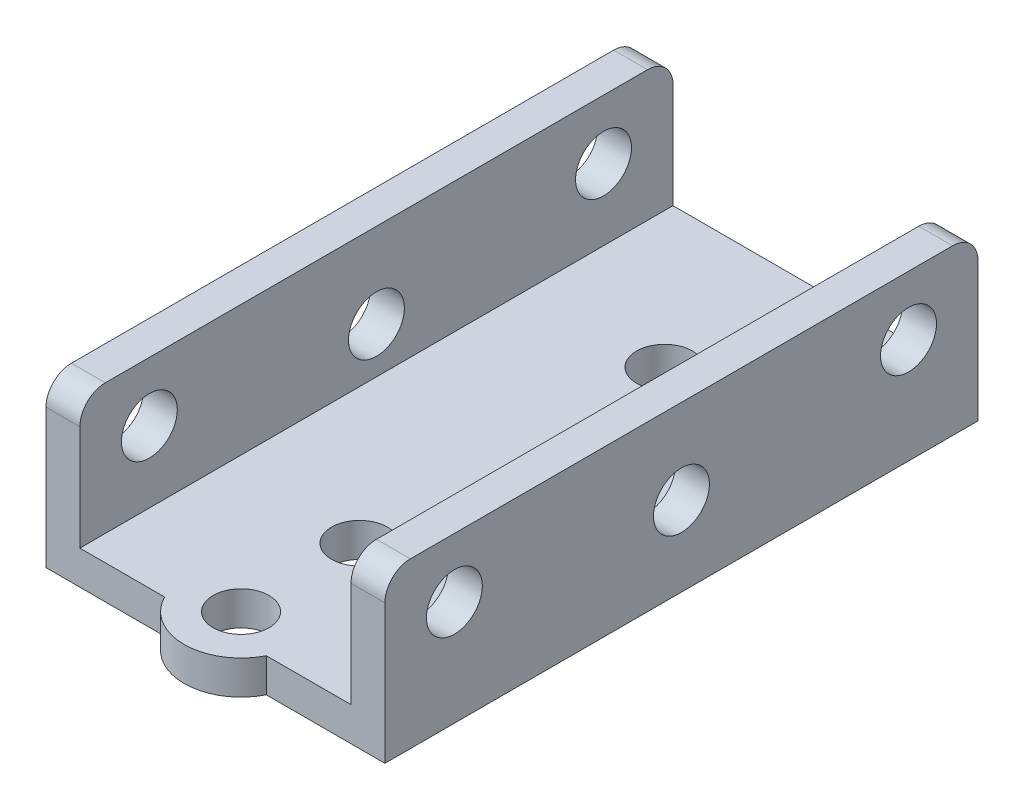
from build123d import *

# Parameters (mm, degrees)
IZIM1_W                     = 16
IZIM1_H                     = 35
IZIM1_R                     = 1.65
Y_KSEKLIK_EKSTR_ZYON1_DEPTH = 2
IZIM3_W                     = 2
IZIM3_H                     = 35
Y_KSEKLIK_EKSTR_ZYON2_DEPTH = 9.7
RADYUS1_R                   = 1.5
KES_EKSTR_ZYON1_DEPTH       = 2
KES_EKSTR_ZYON1_2_DEPTH     = 2
KES_EKSTR_ZYON1_START       = -20
KES_EKSTR_ZYON1_3_OUTLINE_R = 1.65
KES_EKSTR_ZYON1_3_DEPTH     = 20


# Read off the part's stored shape, not the designer's step: Kes-Ekstrüzyon1
with BuildPart() as part:
    # Çizim1 → Yükseklik-Ekstrüzyon1 (new body)
    with BuildSketch(Plane(origin=(0, 0, 0), x_dir=(1, 0, 0), z_dir=(0, 1, 0))):
        Rectangle(IZIM1_W, IZIM1_H)
        with Locations(Location((0, -9, 0), (0, 0, 270))):
            Circle(IZIM1_R, mode=Mode.SUBTRACT)
        with Locations(Location((0, 9, 0), (0, 0, 270))):
            Circle(IZIM1_R, mode=Mode.SUBTRACT)
    extrude(amount=Y_KSEKLIK_EKSTR_ZYON1_DEPTH)

    # Çizim3 → Yükseklik-Ekstrüzyon2 (add)
    with BuildSketch(Plane(origin=(0, 0, 0), x_dir=(1, 0, 0), z_dir=(0, 1, 0))):
        with Locations((9, 0)):
            Rectangle(IZIM3_W, IZIM3_H)
        with Locations((-9, 0)):
            Rectangle(IZIM3_W, IZIM3_H)
    extrude(amount=Y_KSEKLIK_EKSTR_ZYON2_DEPTH)

    # Radyus1
    radyus1_edges = [part.edges().sort_by_distance(p)[0] for p in [
        (9, 9.7, 17.5),
        (9, 9.7, -17.5),
        (-9, 9.7, 17.5),
        (-9, 9.7, -17.5),
    ]]
    fillet(radyus1_edges, radius=RADYUS1_R)

    # Kes-Ekstrüzyon1 outline → Kes-Ekstrüzyon1 (add)
    with BuildSketch(Plane(origin=(0, 0, 0), x_dir=(1, 0, 0), z_dir=(0, 1, 0))):
        with BuildLine():
            ThreePointArc((0.665131566, -17.5), (0, -17.64), (-0.665131566, -17.5))
            Line((-0.665131566, -17.5), (-3, -17.5))
            ThreePointArc((-3, -17.5), (0, -19.348586012), (3, -17.5))
            Line((3, -17.5), (0.665131566, -17.5))
        make_face()
    extrude(amount=KES_EKSTR_ZYON1_DEPTH)

    # Kes-Ekstr_zyon1 2 outline → Kes-Ekstr_zyon1 2 (cut)
    with BuildSketch(Plane(origin=(0, 0, 0), x_dir=(1, 0, 0), z_dir=(0, 1, 0))):
        with BuildLine():
            ThreePointArc((0.665131566, -17.5), (0, -14.34), (-0.665131566, -17.5))
            Line((-0.665131566, -17.5), (0.665131566, -17.5))
        make_face()
    extrude(amount=KES_EKSTR_ZYON1_2_DEPTH, mode=Mode.SUBTRACT)

    # Kes-Ekstr_zyon1 3 outline → Kes-Ekstr_zyon1 3 (cut)
    with BuildSketch(Plane(origin=(10, 0, 0), x_dir=(0, 0, -1), z_dir=(1, 0, 0)).offset(KES_EKSTR_ZYON1_START)):
        with Locations((-13.4, 6.2)):
            Circle(KES_EKSTR_ZYON1_3_OUTLINE_R)
        with Locations((0, 4.7)):
            Circle(KES_EKSTR_ZYON1_3_OUTLINE_R)
        with Locations((13.4, 6.2)):
            Circle(KES_EKSTR_ZYON1_3_OUTLINE_R)
    extrude(amount=KES_EKSTR_ZYON1_3_DEPTH, mode=Mode.SUBTRACT)


solid = part.part
